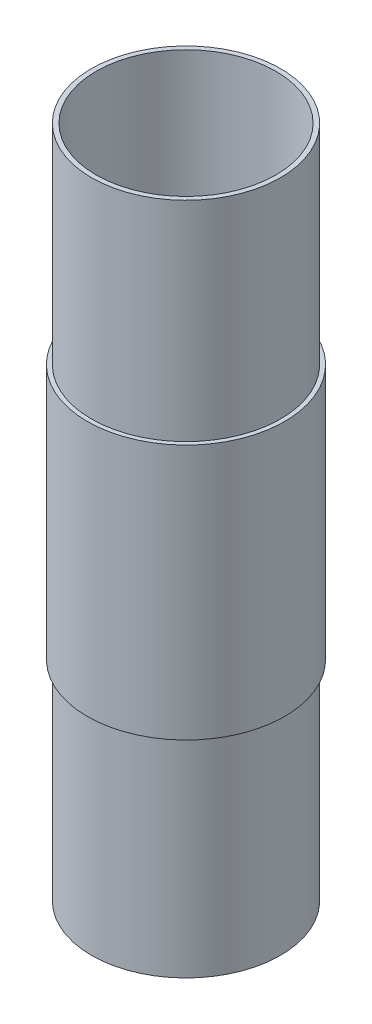
from build123d import *

# Parameters (mm, degrees)
SKETCH1_R           = 40.7
SKETCH1_R_2         = 38.7
BOSS_EXTRUDE1_DEPTH = 145
SKETCH1_3_R         = 42.5
SKETCH1_3_R_2       = 40.7
BOSS_EXTRUDE2_DEPTH = 55


with BuildPart() as part:
    # Sketch1 → Boss-Extrude1 (new, symmetric)
    with BuildSketch(Plane(origin=(0, 0, 0), x_dir=(1, 0, 0), z_dir=(0, 1, 0))):
        Circle(SKETCH1_R)
        Circle(SKETCH1_R_2, mode=Mode.SUBTRACT)
    extrude(amount=BOSS_EXTRUDE1_DEPTH, both=True)

    # Sketch1<3> → Boss-Extrude2 (add, symmetric)
    with BuildSketch(Plane(origin=(0, 0, 0), x_dir=(1, 0, 0), z_dir=(0, 1, 0))):
        Circle(SKETCH1_3_R)
        Circle(SKETCH1_3_R_2, mode=Mode.SUBTRACT)
    extrude(amount=BOSS_EXTRUDE2_DEPTH, both=True)


solid = part.part
